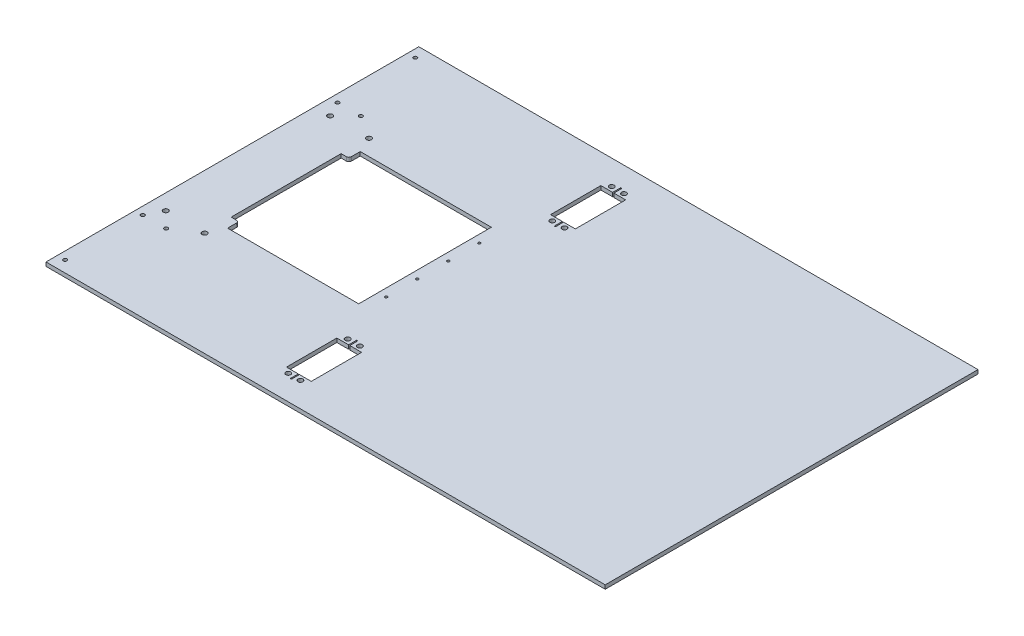
from build123d import *

# Parameters (mm, degrees)
SKETCH1_W           = 457.2
SKETCH1_H           = 304.8
BOSS_EXTRUDE1_DEPTH = 3.175
SKETCH2_R           = 2.063499937
SKETCH2_R_2         = 2.063500064
CUT_EXTRUDE1_DEPTH  = 275.761352131
CUT_EXTRUDE2_REACH  = 276.761
SKETCH5_R           = 1.500000048
CUT_EXTRUDE3_DEPTH  = 275.761352131
SKETCH7_R           = 2.000000064
CUT_EXTRUDE5_DEPTH  = 275.761352131
SKETCH8_R           = 1.000000032
CUT_EXTRUDE6_DEPTH  = 275.761352131


with BuildPart() as part:
    # Sketch1 → Boss-Extrude1 (new body)
    with BuildSketch(Plane(origin=(0, 0, 0), x_dir=(1, 0, 0), z_dir=(0, 1, 0))):
        Rectangle(SKETCH1_W, SKETCH1_H)
    extrude(amount=BOSS_EXTRUDE1_DEPTH)

    # Sketch2 → Cut-Extrude1 (cut, through all)
    with BuildSketch(Plane(origin=(0, 3.175, 0), x_dir=(1, 0, 0), z_dir=(0, 1, 0))):
        with Locations((-184.15, -67.197573915)):
            Circle(SKETCH2_R)
        with Locations((-215.9, -67.197573915)):
            Circle(SKETCH2_R_2)
        with Locations((-184.15, 67.197573915)):
            Circle(SKETCH2_R)
        with Locations((-215.9, 67.197573915)):
            Circle(SKETCH2_R_2)
    extrude(amount=-CUT_EXTRUDE1_DEPTH, mode=Mode.SUBTRACT)

    # Sketch4 → Cut-Extrude2 (cut, up to next)
    with BuildSketch(Plane(origin=(0, 3.175, 0), x_dir=(1, 0, 0), z_dir=(0, 1, 0)), mode=Mode.PRIVATE) as cut_extrude2_sk1:
        with BuildLine():
            Line((-184.658, 44.958), (-184.658, -44.958))
            Line((-184.658, -44.958), (-180.34, -44.958))
            ThreePointArc((-180.34, -44.958), (-178.903159021, -45.553159021), (-178.308, -46.99))
            Line((-178.308, -46.99), (-178.308, -54.229))
            Line((-178.308, -54.229), (-71.12, -54.229))
            Line((-71.12, -54.229), (-71.12, 54.229))
            Line((-71.12, 54.229), (-178.308, 54.229))
            Line((-178.308, 54.229), (-178.308, 46.99))
            ThreePointArc((-178.308, 46.99), (-178.903159021, 45.553159021), (-180.34, 44.958))
            Line((-180.34, 44.958), (-184.658, 44.958))
        make_face()
    cut_extrude2_tool1 = extrude(cut_extrude2_sk1.sketch, amount=-CUT_EXTRUDE2_REACH, mode=Mode.PRIVATE) & part.part
    add(cut_extrude2_tool1.solids().sort_by_distance((-127.379078, 3.175, 0))[0], mode=Mode.SUBTRACT)

    # Sketch5 → Cut-Extrude3 (cut, through all)
    with BuildSketch(Plane(origin=(0, 3.175, 0), x_dir=(1, 0, 0), z_dir=(0, 1, 0))):
        with Locations((-203.2, 79.629)):
            Circle(SKETCH5_R)
        with Locations((-222.25, 143.129)):
            Circle(SKETCH5_R)
        with Locations((-222.25, 79.629)):
            Circle(SKETCH5_R)
        with Locations((-203.2, -79.629)):
            Circle(SKETCH5_R)
        with Locations((-222.25, -79.629)):
            Circle(SKETCH5_R)
        with Locations((-222.25, -143.129)):
            Circle(SKETCH5_R)
    extrude(amount=-CUT_EXTRUDE3_DEPTH, mode=Mode.SUBTRACT)

    # Sketch7 → Cut-Extrude5 (cut, through all)
    with BuildSketch(Plane(origin=(0, 3.175, 0), x_dir=(1, 0, 0), z_dir=(0, 1, 0))):
        with Locations((-50.720000033, -132.250000041)):
            Circle(SKETCH7_R)
        with Locations((-40.719999967, -132.250000041)):
            Circle(SKETCH7_R)
        with Locations((-50.720000033, -83.649999959)):
            Circle(SKETCH7_R)
        with Locations((-40.719999967, -83.649999959)):
            Circle(SKETCH7_R)
        Polygon((-55.846999939, -87.373000006), (-46.22, -87.373000006), (-46.22, -80.769000006), (-45.22, -80.769000006), (-45.22, -87.373000006), (-35.593000061, -87.373000006), (-35.593000061, -128.526999994), (-45.22, -128.526999994), (-45.22, -135.130999994), (-46.22, -135.130999994), (-46.22, -128.526999994), (-55.846999939, -128.526999994), align=None)
    cut_extrude5 = extrude(amount=-CUT_EXTRUDE5_DEPTH, mode=Mode.SUBTRACT)

    # Mirror1: Cut-Extrude5 across plane
    add(cut_extrude5.mirror(Plane.XY), mode=Mode.SUBTRACT)

    # Sketch8 → Cut-Extrude6 (cut, through all)
    with BuildSketch(Plane(origin=(0, 3.175, 0), x_dir=(1, 0, 0), z_dir=(0, 1, 0))):
        with Locations((-64.77, -38.1)):
            Circle(SKETCH8_R)
        with Locations((-64.77, -12.7)):
            Circle(SKETCH8_R)
        with Locations((-64.77, 12.7)):
            Circle(SKETCH8_R)
        with Locations((-64.77, 38.1)):
            Circle(SKETCH8_R)
    extrude(amount=-CUT_EXTRUDE6_DEPTH, mode=Mode.SUBTRACT)


solid = part.part
